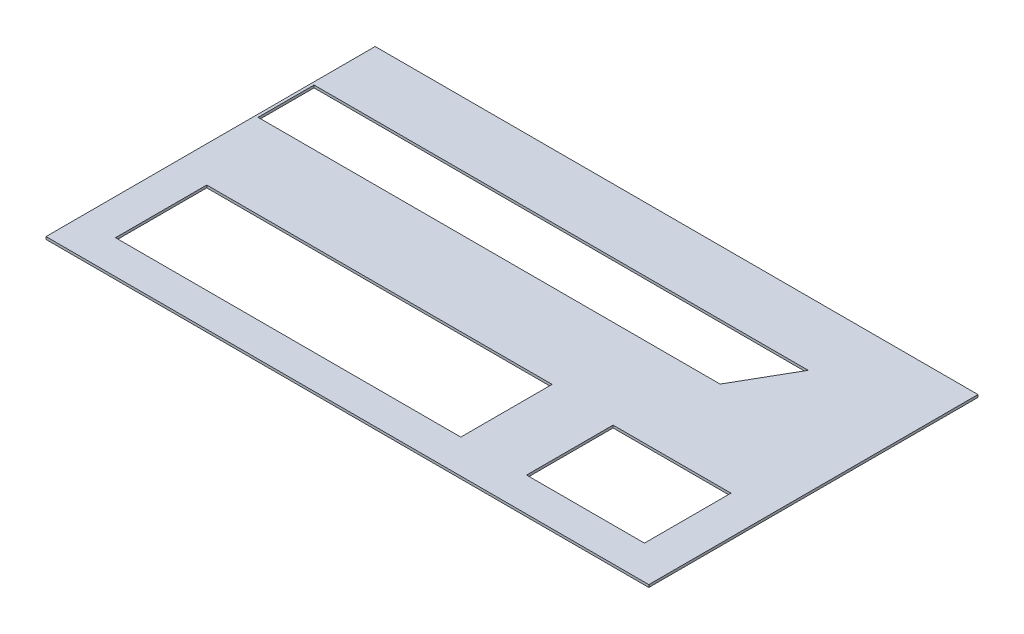
from build123d import *

# Parameters (mm, degrees)
SKETCH1_W           = 1518.68
SKETCH1_H           = 829.31
BOSS_EXTRUDE1_DEPTH = 6.35
CUT_EXTRUDE1_REACH  = 1732.371
SKETCH2_W           = 870
SKETCH2_H           = 230
SKETCH2_W_2         = 297
SKETCH2_H_2         = 218


with BuildPart() as part:
    # Sketch1 → Boss-Extrude1 (new body)
    with BuildSketch(Plane(origin=(0, 0, 0), x_dir=(1, 0, 0), z_dir=(0, 1, 0))):
        with Locations((759.34, 414.655)):
            Rectangle(SKETCH1_W, SKETCH1_H)
    extrude(amount=BOSS_EXTRUDE1_DEPTH)

    # Sketch2 → Cut-Extrude1 (cut, up to next)
    with BuildSketch(Plane(origin=(0, 6.35, 0), x_dir=(1, 0, 0), z_dir=(0, 1, 0)), mode=Mode.PRIVATE) as cut_extrude1_sk1:
        with Locations((525, 200)):
            Rectangle(SKETCH2_W, SKETCH2_H)
    cut_extrude1_tool1 = extrude(cut_extrude1_sk1.sketch, amount=-CUT_EXTRUDE1_REACH, mode=Mode.PRIVATE) & part.part
    # Sketch2 → Cut-Extrude1 (cut, up to next)
    with BuildSketch(Plane(origin=(0, 6.35, 0), x_dir=(1, 0, 0), z_dir=(0, 1, 0)), mode=Mode.PRIVATE) as cut_extrude1_sk2:
        Polygon((7, 668.31), (1252, 668.31), (1171, 527.31), (7, 527.31), align=None)
    cut_extrude1_tool2 = extrude(cut_extrude1_sk2.sketch, amount=-CUT_EXTRUDE1_REACH, mode=Mode.PRIVATE) & part.part
    # Sketch2 → Cut-Extrude1 (cut, up to next)
    with BuildSketch(Plane(origin=(0, 6.35, 0), x_dir=(1, 0, 0), z_dir=(0, 1, 0)), mode=Mode.PRIVATE) as cut_extrude1_sk3:
        with Locations((1274.18, 194)):
            Rectangle(SKETCH2_W_2, SKETCH2_H_2)
    cut_extrude1_tool3 = extrude(cut_extrude1_sk3.sketch, amount=-CUT_EXTRUDE1_REACH, mode=Mode.PRIVATE) & part.part
    add(cut_extrude1_tool1.solids().sort_by_distance((525, 6.35, -200))[0], mode=Mode.SUBTRACT)
    add(cut_extrude1_tool2.solids().sort_by_distance((609.476961, 6.35, -598.600162))[0], mode=Mode.SUBTRACT)
    add(cut_extrude1_tool3.solids().sort_by_distance((1274.18, 6.35, -194))[0], mode=Mode.SUBTRACT)


solid = part.part
